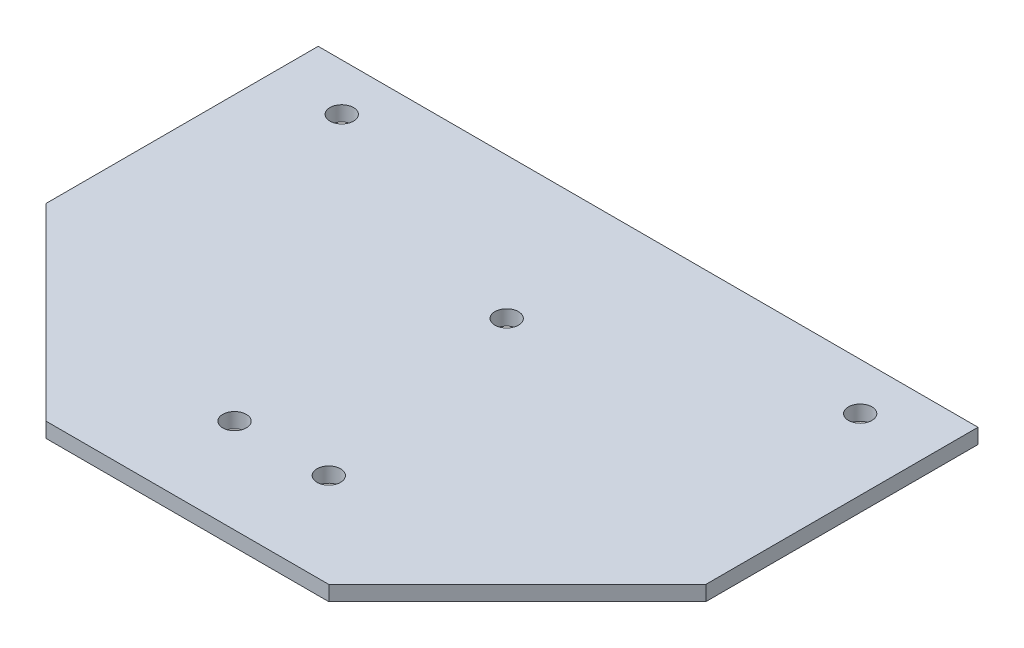
from build123d import *

# Parameters (mm, degrees)
SKETCH1_R           = 2.5
BOSS_EXTRUDE1_DEPTH = 3.18
CUT_EXTRUDE1_DEPTH  = 133.911404727


with BuildPart() as part:
    # Sketch1 → Boss-Extrude1 (new body)
    with BuildSketch(Plane(origin=(0, 0, 0), x_dir=(1, 0, 0), z_dir=(0, 1, 0))):
        Polygon((0, 0), (40, 0), (90, 0), (90, 40), (90, 57.751363706), (90, 97.751363706), (-50, 97.751363706), (-50, 0), align=None)
        with Locations((-35, 87.751363706)):
            Circle(SKETCH1_R, mode=Mode.SUBTRACT)
        with Locations((75, 87.751363706)):
            Circle(SKETCH1_R, mode=Mode.SUBTRACT)
        with Locations((20, 67.751363706)):
            Circle(SKETCH1_R, mode=Mode.SUBTRACT)
        with Locations((10, 20)):
            Circle(SKETCH1_R, mode=Mode.SUBTRACT)
        with Locations((30, 20)):
            Circle(SKETCH1_R, mode=Mode.SUBTRACT)
    extrude(amount=BOSS_EXTRUDE1_DEPTH)

    # Sketch3 → Cut-Extrude1 (cut, through all)
    with BuildSketch(Plane.XZ):
        Polygon((90, -40), (50, 0), (90, 0), align=None)
        Polygon((-50, 0), (-10, 0), (-50, -40), align=None)
    extrude(amount=-CUT_EXTRUDE1_DEPTH, mode=Mode.SUBTRACT)


solid = part.part
